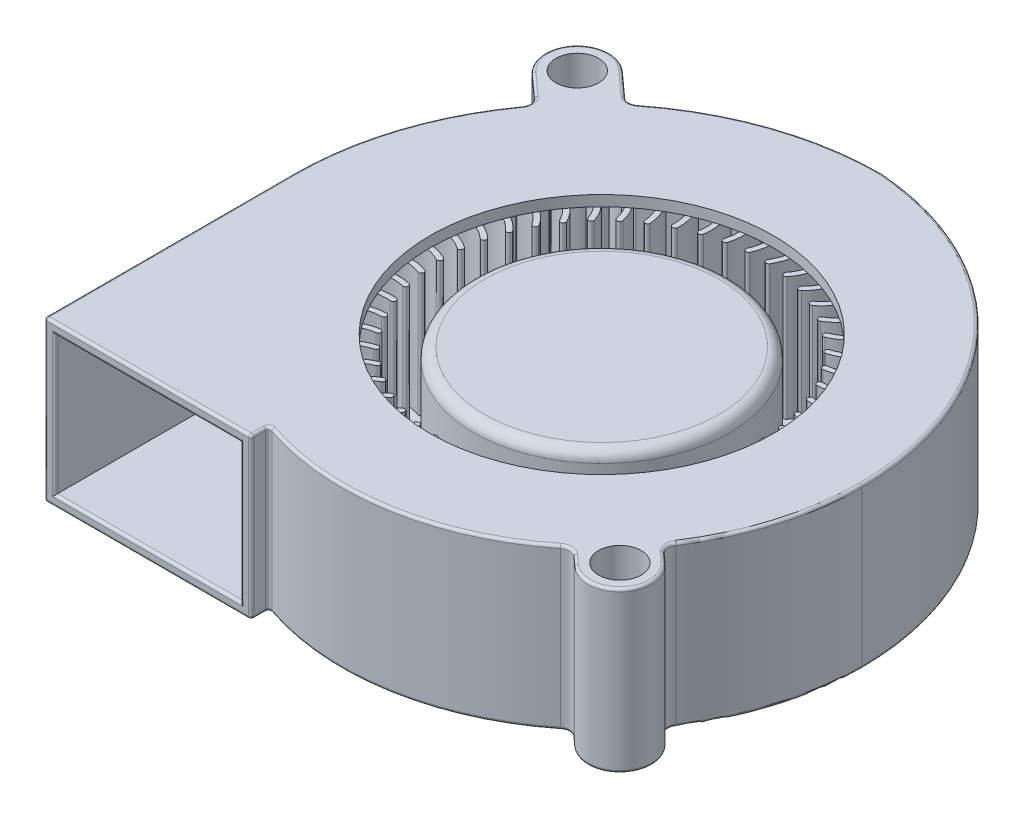
from build123d import *

# Parameters (mm, degrees)
BODY_DEPTH          = 7.499999986
BODY_DEPTH_BACK     = 7.499999986
SKETCH1_R           = 2
SKETCH1_R_2         = 16.1
SHELL_START         = -6.499999986
SHELL_OUTLINE_R     = 16.1
SHELL_DEPTH         = 12.999999972
SKETCH2_R           = 20.1
BOSS_EXTRUDE2_DEPTH = 1
SKETCH3_R           = 12
MOTOR_DEPTH         = 12.799999972
FILLET1_R           = 1
FILLET2_R           = 0.25
SKETCH9_R           = 19
BLADE_BASE_DEPTH    = 1
BLADE_DEPTH         = 11.599999972
BLADE_2_DEPTH       = 11.599999972
BLADE_3_DEPTH       = 11.599999972
BLADE_4_DEPTH       = 11.599999972
BLADE_5_DEPTH       = 11.599999972
BLADE_6_DEPTH       = 11.599999972
BLADE_7_DEPTH       = 11.599999972
BLADE_8_DEPTH       = 11.599999972
BLADE_9_DEPTH       = 11.599999972
BLADE_10_DEPTH      = 11.599999972
BLADE_11_DEPTH      = 11.599999972
BLADE_12_DEPTH      = 11.599999972
BLADE_13_DEPTH      = 11.599999972
BLADE_14_DEPTH      = 11.599999972
BLADE_15_DEPTH      = 11.599999972
BLADE_16_DEPTH      = 11.599999972
BLADE_17_DEPTH      = 11.599999972
BLADE_18_DEPTH      = 11.599999972
BLADE_19_DEPTH      = 11.599999972
BLADE_20_DEPTH      = 11.599999972
BLADE_21_DEPTH      = 11.599999972
BLADE_22_DEPTH      = 11.599999972
BLADE_23_DEPTH      = 11.599999972
BLADE_24_DEPTH      = 11.599999972
BLADE_25_DEPTH      = 11.599999972
BLADE_26_DEPTH      = 11.599999972
BLADE_27_DEPTH      = 11.599999972
BLADE_28_DEPTH      = 11.599999972
BLADE_29_DEPTH      = 11.599999972
BLADE_30_DEPTH      = 11.599999972
BLADE_31_DEPTH      = 11.599999972
BLADE_32_DEPTH      = 11.599999972
BLADE_33_DEPTH      = 11.599999972
BLADE_34_DEPTH      = 11.599999972
BLADE_35_DEPTH      = 11.599999972
BLADE_36_DEPTH      = 11.599999972
BLADE_37_DEPTH      = 11.599999972
BLADE_38_DEPTH      = 11.599999972
BLADE_39_DEPTH      = 11.599999972
BLADE_40_DEPTH      = 11.599999972
BLADE_41_DEPTH      = 11.599999972
BLADE_42_DEPTH      = 11.599999972
BLADE_43_DEPTH      = 11.599999972
BLADE_44_DEPTH      = 11.599999972
BLADE_45_DEPTH      = 11.599999972
BLADE_46_DEPTH      = 11.599999972
BLADE_47_DEPTH      = 11.599999972
BLADE_48_DEPTH      = 11.599999972
BLADE_49_DEPTH      = 11.599999972
BLADE_50_DEPTH      = 11.599999972


# Read off the part's stored shape, not the designer's step: Shell
with BuildPart() as part:
    # Sketch1 → BODY (new, two sides: drawn at the far end of the back side and taken through both)
    with BuildSketch(Plane(origin=(0, 0, 0), x_dir=(1, 0, 0), z_dir=(0, 1, 0)).offset(-BODY_DEPTH_BACK)):
        with BuildLine():
            Line((-8.2, -24.7), (-27.6, -24.7))
            Line((-27.6, -24.7), (-27.6, -1.3))
            ThreePointArc((-27.6, -1.3), (-26.262276369, 7.188394425), (-22.378779717, 14.853953646))
            ThreePointArc((-22.378779717, 14.853953646), (-22.195118856, 15.544109225), (-22.518691745, 16.1807776))
            Line((-22.518691745, 16.1807776), (-24.612739972, 18.075392663))
            ThreePointArc((-24.612739972, 18.075392663), (-24.824607337, 22.312739972), (-20.587260028, 22.524607337))
            Line((-20.587260028, 22.524607337), (-18.314120005, 20.467956841))
            ThreePointArc((-18.314120005, 20.467956841), (-17.678523285, 20.210116446), (-17.026311343, 20.422447423))
            ThreePointArc((-17.026311343, 20.422447423), (-9.00612156, 24.789265502), (0, 26.3))
            ThreePointArc((0, 26.3), (17.36055533, 17.937739545), (24.4, 0))
            ThreePointArc((24.4, 0), (23.375338292, -6.996682051), (20.387413137, -13.405722121))
            ThreePointArc((20.387413137, -13.405722121), (20.23099708, -14.081643481), (20.552049532, -14.696672741))
            Line((20.552049532, -14.696672741), (21.412739972, -15.475392663))
            ThreePointArc((21.412739972, -15.475392663), (21.624607337, -19.712739972), (17.387260028, -19.924607337))
            Line((17.387260028, -19.924607337), (16.500680289, -19.122463764))
            ThreePointArc((16.500680289, -19.122463764), (15.861055579, -18.864489151), (15.206547793, -19.081952317))
            ThreePointArc((15.206547793, -19.081952317), (4.009152204, -24.068375487), (-8.2, -22.980861603))
            Line((-8.2, -22.980861603), (-8.2, -24.7))
        make_face()
        with Locations(Location((-22.6, 20.3, 0), (0, 0, 270))):
            Circle(SKETCH1_R, mode=Mode.SUBTRACT)
        with Locations(Location((19.4, -17.7, 0), (0, 0, 270))):
            Circle(SKETCH1_R, mode=Mode.SUBTRACT)
        with Locations(Location((0, 0, 0), (0, 0, 270))):
            Circle(SKETCH1_R_2, mode=Mode.SUBTRACT)
    extrude(amount=BODY_DEPTH + BODY_DEPTH_BACK)

    # Shell outline → Shell (cut)
    with BuildSketch(Plane(origin=(0, 0, 0), x_dir=(1, 0, 0), z_dir=(0, 1, 0)).offset(SHELL_START)):
        with BuildLine():
            ThreePointArc((-19.600048942, 20.282863759), (-20.375392663, 18.287260028), (-22.283702238, 17.316720642))
            Line((-22.283702238, 17.316720642), (-21.847778421, 16.922313379))
            ThreePointArc((-21.847778421, 16.922313379), (-21.200632643, 15.648976628), (-21.567954365, 14.26866547))
            ThreePointArc((-21.567954365, 14.26866547), (-25.310744617, 6.880843902), (-26.6, -1.3))
            Line((-26.6, -1.3), (-26.6, -24.7))
            Line((-26.6, -24.7), (-9.2, -24.7))
            Line((-9.2, -24.7), (-9.2, -21.515575753))
            ThreePointArc((-9.2, -21.515575753), (3.135313575, -23.189001893), (14.583328621, -18.299905091))
            ThreePointArc((14.583328621, -18.299905091), (15.453748302, -17.899665059), (16.410447581, -17.950152626))
            ThreePointArc((16.410447581, -17.950152626), (17.180842903, -15.681252424), (19.366916719, -14.700182423))
            ThreePointArc((19.366916719, -14.700182423), (19.232948318, -13.755532004), (19.551863418, -12.85630728))
            ThreePointArc((19.551863418, -12.85630728), (22.417332624, -6.709932787), (23.4, 0))
            ThreePointArc((23.4, 0), (16.64019784, 17.243873762), (-0.037492747, 25.299973577))
            ThreePointArc((-0.037492747, 25.299973577), (-8.697530915, 23.837878908), (-16.409416004, 19.635402227))
            ThreePointArc((-16.409416004, 19.635402227), (-17.713839887, 19.210740271), (-18.985033329, 19.726421061))
            Line((-18.985033329, 19.726421061), (-19.600048942, 20.282863759))
        make_face()
        Circle(SHELL_OUTLINE_R, mode=Mode.SUBTRACT)
    extrude(amount=SHELL_DEPTH, mode=Mode.SUBTRACT)

    # Sketch2 → Boss-Extrude2 (add)
    with BuildSketch(Plane.XZ.offset(7.499999986)):
        Circle(SKETCH2_R)
    extrude(amount=-BOSS_EXTRUDE2_DEPTH)

    # Fillet2
    fillet2_edges = [part.edges().sort_by_distance(p)[0] for p in [
        (15.861055579, -7.499999986, 18.864489151),
        (-9.2, 0, 24.7),
        (-17.9, -6.499999986, 24.7),
        (-26.6, 0, 24.7),
        (-17.9, 6.499999986, 24.7),
        (16.943970158, -7.499999986, 19.523535551),
        (21.624607337, -7.499999986, 19.712739972),
        (20.982394752, -7.499999986, 15.086032702),
        (20.23099708, -7.499999986, 14.081643481),
        (23.375338292, -7.499999986, 6.996682051),
        (17.36055533, -7.499999986, -17.937739545),
        (-8.2, 0, 24.7),
        (-27.6, 0, 24.7),
        (-8.2, 0, 22.980861603),
        (-9.00612156, -7.499999986, -24.789265502),
        (-17.678523285, -7.499999986, -20.210116446),
        (-19.450690017, -7.499999986, -21.496282089),
        (-8.2, -7.499999986, 23.840430801),
        (-24.824607337, -7.499999986, -22.312739972),
        (-23.565715858, -7.499999986, -17.128085131),
        (-22.195118856, -7.499999986, -15.544109225),
        (-26.262276369, -7.499999986, -7.188394425),
        (-27.6, -7.499999986, 13),
        (-8.2, 7.499999986, 23.840430801),
        (4.009152204, 7.499999986, 24.068375487),
        (15.861055579, 7.499999986, 18.864489151),
        (16.943970158, 7.499999986, 19.523535551),
        (21.624607337, 7.499999986, 19.712739972),
        (20.982394752, 7.499999986, 15.086032702),
        (20.23099708, 7.499999986, 14.081643481),
        (-17.9, -7.499999986, 24.7),
        (23.375338292, 7.499999986, 6.996682051),
        (17.36055533, 7.499999986, -17.937739545),
        (-9.00612156, 7.499999986, -24.789265502),
        (-17.678523285, 7.499999986, -20.210116446),
        (-19.450690017, 7.499999986, -21.496282089),
        (-24.824607337, 7.499999986, -22.312739972),
        (-23.565715858, 7.499999986, -17.128085131),
        (-22.195118856, 7.499999986, -15.544109225),
        (-26.262276369, 7.499999986, -7.188394425),
        (-27.6, 7.499999986, 13),
        (-17.9, 7.499999986, 24.7),
        (4.009152204, -7.499999986, 24.068375487),
    ]]
    fillet(fillet2_edges, radius=FILLET2_R)


with BuildPart() as body_2:
    # Sketch3 → MOTOR (new body)
    with BuildSketch(Plane(origin=(0, -6.299999986, 0), x_dir=(1, 0, 0), z_dir=(0, 1, 0))):
        with Locations(Location((0, 0, 0), (0, 0, 90))):
            Circle(SKETCH3_R)
    extrude(amount=MOTOR_DEPTH)

    # Fillet1
    fillet1_edges = [body_2.edges().sort_by_distance(p)[0] for p in [
        (0, 6.499999986, 12),
    ]]
    fillet(fillet1_edges, radius=FILLET1_R)


with BuildPart() as body_3:
    # Sketch9 → BLADE BASE (new body)
    with BuildSketch(Plane(origin=(0, -6.299999986, 0), x_dir=(1, 0, 0), z_dir=(0, 1, 0))):
        with Locations(Location((0, 0, 0), (0, 0, 270))):
            Circle(SKETCH9_R)
    extrude(amount=BLADE_BASE_DEPTH)


with BuildPart() as body_4:
    # Sketch10 → BLADE (new body)
    with BuildSketch(Plane(origin=(0, -5.299999986, 0), x_dir=(1, 0, 0), z_dir=(0, 1, 0))):
        with BuildLine():
            ThreePointArc((-18.866349436, 0), (-16.866349436, 0.5), (-14.866349436, 0))
            ThreePointArc((-14.866349436, 0), (-14.76340826, -0.338235294), (-15.101643554, -0.441176471))
            ThreePointArc((-15.101643554, -0.441176471), (-16.866349436, 0), (-18.631055318, -0.441176471))
            ThreePointArc((-18.631055318, -0.441176471), (-18.969290613, -0.338235294), (-18.866349436, 0))
        make_face()
    extrude(amount=BLADE_DEPTH)


with BuildPart() as body_5:
    # Sketch10 → BLADE 2 (new body)
    with BuildSketch(Plane(origin=(0, -5.299999986, 0), x_dir=(1, 0, 0), z_dir=(0, 1, 0))):
        with BuildLine():
            ThreePointArc((-18.717582636, 2.36458058), (-18.862104213, 2.041914323), (-18.539437956, 1.897392745))
            ThreePointArc((-18.539437956, 1.897392745), (-16.733353233, 2.113914113), (-15.037856657, 1.455040156))
            ThreePointArc((-15.037856657, 1.455040156), (-14.689386499, 1.514777488), (-14.74912383, 1.863247646))
            ThreePointArc((-14.74912383, 1.863247646), (-16.670686616, 2.609971464), (-18.717582636, 2.36458058))
        make_face()
    extrude(amount=BLADE_2_DEPTH)


with BuildPart() as body_6:
    # Sketch10 → BLADE 3 (new body)
    with BuildSketch(Plane(origin=(0, -5.299999986, 0), x_dir=(1, 0, 0), z_dir=(0, 1, 0))):
        with BuildLine():
            ThreePointArc((-18.273628376, 4.691870312), (-18.457451163, 4.389861732), (-18.155442582, 4.206038944))
            ThreePointArc((-18.155442582, 4.206038944), (-16.336462053, 4.194490538), (-14.736913778, 3.328309931))
            ThreePointArc((-14.736913778, 3.328309931), (-14.383704338, 3.343901324), (-14.399295731, 3.697110764))
            ThreePointArc((-14.399295731, 3.697110764), (-16.21211711, 4.678782119), (-18.273628376, 4.691870312))
        make_face()
    extrude(amount=BLADE_3_DEPTH)


with BuildPart() as body_7:
    # Sketch10 → BLADE 4 (new body)
    with BuildSketch(Plane(origin=(0, -5.299999986, 0), x_dir=(1, 0, 0), z_dir=(0, 1, 0))):
        with BuildLine():
            ThreePointArc((-17.54148808, 6.945166447), (-17.761713082, 6.668578398), (-17.485125033, 6.448353397))
            ThreePointArc((-17.485125033, 6.448353397), (-15.681935108, 6.208917342), (-14.203560965, 5.14909027))
            ThreePointArc((-14.203560965, 5.14909027), (-13.851182568, 5.120289838), (-13.822382137, 5.472668236))
            ThreePointArc((-13.822382137, 5.472668236), (-15.497872832, 6.673805585), (-17.54148808, 6.945166447))
        make_face()
    extrude(amount=BLADE_4_DEPTH)


with BuildPart() as body_8:
    # Sketch10 → BLADE 5 (new body)
    with BuildSketch(Plane(origin=(0, -5.299999986, 0), x_dir=(1, 0, 0), z_dir=(0, 1, 0))):
        with BuildLine():
            ThreePointArc((-16.532708039, 9.088933158), (-16.785862175, 8.8421276), (-16.539056617, 8.588973464))
            ThreePointArc((-16.539056617, 8.588973464), (-14.780094679, 8.12542581), (-13.446209511, 6.888666379))
            ThreePointArc((-13.446209511, 6.888666379), (-13.100219374, 6.815928324), (-13.027481319, 7.161918461))
            ThreePointArc((-13.027481319, 7.161918461), (-14.539217842, 8.56357915), (-16.532708039, 9.088933158))
        make_face()
    extrude(amount=BLADE_5_DEPTH)


with BuildPart() as body_9:
    # Sketch10 → BLADE 6 (new body)
    with BuildSketch(Plane(origin=(0, -5.299999986, 0), x_dir=(1, 0, 0), z_dir=(0, 1, 0))):
        with BuildLine():
            ThreePointArc((-15.263197316, 11.089361963), (-15.545288194, 10.876231167), (-15.332157399, 10.594140289))
            ThreePointArc((-15.332157399, 10.594140289), (-13.645163327, 9.913791459), (-12.476803301, 8.519604104))
            ThreePointArc((-12.476803301, 8.519604104), (-12.142657895, 8.404075548), (-12.027129338, 8.738220954))
            ThreePointArc((-12.027129338, 8.738220954), (-13.351270701, 10.318299956), (-15.263197316, 11.089361963))
        make_face()
    extrude(amount=BLADE_6_DEPTH)


with BuildPart() as body_10:
    # Sketch10 → BLADE 7 (new body)
    with BuildSketch(Plane(origin=(0, -5.299999986, 0), x_dir=(1, 0, 0), z_dir=(0, 1, 0))):
        with BuildLine():
            ThreePointArc((-13.752976853, 12.914904906), (-14.059555733, 12.738810072), (-13.883460899, 12.432231192))
            ThreePointArc((-13.883460899, 12.432231192), (-12.295039598, 11.545810694), (-11.310630449, 10.016182583))
            ThreePointArc((-11.310630449, 10.016182583), (-10.993599447, 9.85968548), (-10.837102343, 10.176716482))
            ThreePointArc((-10.837102343, 10.176716482), (-11.952766045, 11.910295008), (-13.752976853, 12.914904906))
        make_face()
    extrude(amount=BLADE_7_DEPTH)


with BuildPart() as body_11:
    # Sketch10 → BLADE 8 (new body)
    with BuildSketch(Plane(origin=(0, -5.299999986, 0), x_dir=(1, 0, 0), z_dir=(0, 1, 0))):
        with BuildLine():
            ThreePointArc((-12.02586373, 14.536772083), (-12.352095678, 14.400490332), (-12.215813927, 14.074258384))
            ThreePointArc((-12.215813927, 14.074258384), (-10.75101575, 12.995745598), (-9.966082199, 11.35479988))
            ThreePointArc((-9.966082199, 11.35479988), (-9.671165368, 11.159802282), (-9.476167771, 11.454719112))
            ThreePointArc((-9.476167771, 11.454719112), (-10.365759129, 13.314457593), (-12.02586373, 14.536772083))
        make_face()
    extrude(amount=BLADE_8_DEPTH)


with BuildPart() as body_12:
    # Sketch10 → BLADE 9 (new body)
    with BuildSketch(Plane(origin=(0, -5.299999986, 0), x_dir=(1, 0, 0), z_dir=(0, 1, 0))):
        with BuildLine():
            ThreePointArc((-10.109095551, 15.929385681), (-10.449835696, 15.835066258), (-10.355516273, 15.494326113))
            ThreePointArc((-10.355516273, 15.494326113), (-9.037441961, 14.24072983), (-8.464362878, 12.514345199))
            ThreePointArc((-8.464362878, 12.514345199), (-8.196211235, 12.283922336), (-7.965788371, 12.552073979))
            ThreePointArc((-7.965788371, 12.552073979), (-8.615277999, 14.508643228), (-10.109095551, 15.929385681))
        make_face()
    extrude(amount=BLADE_9_DEPTH)


with BuildPart() as body_13:
    # Sketch10 → BLADE 10 (new body)
    with BuildSketch(Plane(origin=(0, -5.299999986, 0), x_dir=(1, 0, 0), z_dir=(0, 1, 0))):
        with BuildLine():
            ThreePointArc((-8.032900897, 17.070783351), (-8.382775563, 17.019913728), (-8.33190594, 16.670039063))
            ThreePointArc((-8.33190594, 16.670039063), (-7.181342314, 15.261129246), (-6.829155499, 13.476531819))
            ThreePointArc((-6.829155499, 13.476531819), (-6.591997954, 13.214317596), (-6.329783731, 13.451475141))
            ThreePointArc((-6.329783731, 13.451475141), (-6.728928788, 15.474018892), (-8.032900897, 17.070783351))
        make_face()
    extrude(amount=BLADE_10_DEPTH)


with BuildPart() as body_14:
    # Sketch10 → BLADE 11 (new body)
    with BuildSketch(Plane(origin=(0, -5.299999986, 0), x_dir=(1, 0, 0), z_dir=(0, 1, 0))):
        with BuildLine():
            ThreePointArc((-5.830022598, 17.94296457), (-6.183514051, 17.936346993), (-6.176896474, 17.582855539))
            ThreePointArc((-6.176896474, 17.582855539), (-5.211988609, 16.040851537), (-5.086248258, 14.226185482))
            ThreePointArc((-5.086248258, 14.226185482), (-4.883824928, 13.936315174), (-4.59395462, 14.138738505))
            ThreePointArc((-4.59395462, 14.138738505), (-4.736460351, 16.195360034), (-5.830022598, 17.94296457))
        make_face()
    extrude(amount=BLADE_11_DEPTH)


with BuildPart() as body_15:
    # Sketch10 → BLADE 12 (new body)
    with BuildSketch(Plane(origin=(0, -5.299999986, 0), x_dir=(1, 0, 0), z_dir=(0, 1, 0))):
        with BuildLine():
            ThreePointArc((-3.535201359, 18.532174519), (-3.886734829, 18.56991335), (-3.92447366, 18.21837988))
            ThreePointArc((-3.92447366, 18.21837988), (-3.16043873, 16.567600017), (-3.263127844, 14.751483701))
            ThreePointArc((-3.263127844, 14.751483701), (-3.098631065, 14.438528737), (-2.7856761, 14.603025516))
            ThreePointArc((-2.7856761, 14.603025516), (-2.669295104, 16.661290675), (-3.535201359, 18.532174519))
        make_face()
    extrude(amount=BLADE_12_DEPTH)


with BuildPart() as body_16:
    # Sketch10 → BLADE 13 (new body)
    with BuildSketch(Plane(origin=(0, -5.299999986, 0), x_dir=(1, 0, 0), z_dir=(0, 1, 0))):
        with BuildLine():
            ThreePointArc((-1.184627883, 18.829121005), (-1.528659477, 18.910621081), (-1.610159552, 18.566589487))
            ThreePointArc((-1.610159552, 18.566589487), (-1.059046844, 16.833067548), (-1.388545954, 15.04414221))
            ThreePointArc((-1.388545954, 15.04414221), (-1.264569939, 14.713038076), (-0.933465805, 14.837014091))
            ThreePointArc((-0.933465805, 14.837014091), (-0.560033479, 16.864462808), (-1.184627883, 18.829121005))
        make_face()
    extrude(amount=BLADE_13_DEPTH)


with BuildPart() as body_17:
    # Sketch10 → BLADE 14 (new body)
    with BuildSketch(Plane(origin=(0, -5.299999986, 0), x_dir=(1, 0, 0), z_dir=(0, 1, 0))):
        with BuildLine():
            ThreePointArc((1.184627883, 18.829121005), (0.853523749, 18.95309702), (0.729547733, 18.621992886))
            ThreePointArc((0.729547733, 18.621992886), (1.059046844, 16.833067548), (0.507934135, 15.09954561))
            ThreePointArc((0.507934135, 15.09954561), (0.589434211, 14.755514016), (0.933465805, 14.837014091))
            ThreePointArc((0.933465805, 14.837014091), (1.558060208, 16.801672288), (1.184627883, 18.829121005))
        make_face()
    extrude(amount=BLADE_14_DEPTH)


with BuildPart() as body_18:
    # Sketch10 → BLADE 15 (new body)
    with BuildSketch(Plane(origin=(0, -5.299999986, 0), x_dir=(1, 0, 0), z_dir=(0, 1, 0))):
        with BuildLine():
            ThreePointArc((3.535201359, 18.532174519), (3.222246395, 18.696671298), (3.057749615, 18.383716334))
            ThreePointArc((3.057749615, 18.383716334), (3.16043873, 16.567600017), (2.396403799, 14.916820155))
            ThreePointArc((2.396403799, 14.916820155), (2.43414263, 14.565286685), (2.7856761, 14.603025516))
            ThreePointArc((2.7856761, 14.603025516), (3.651582355, 16.47390936), (3.535201359, 18.532174519))
        make_face()
    extrude(amount=BLADE_15_DEPTH)


with BuildPart() as body_19:
    # Sketch10 → BLADE 16 (new body)
    with BuildSketch(Plane(origin=(0, -5.299999986, 0), x_dir=(1, 0, 0), z_dir=(0, 1, 0))):
        with BuildLine():
            ThreePointArc((5.830022598, 17.94296457), (5.54015229, 18.145387901), (5.337728959, 17.855517593))
            ThreePointArc((5.337728959, 17.855517593), (5.211988609, 16.040851537), (4.247080744, 14.498847535))
            ThreePointArc((4.247080744, 14.498847535), (4.240463167, 14.145356082), (4.59395462, 14.138738505))
            ThreePointArc((4.59395462, 14.138738505), (5.687516867, 15.88634304), (5.830022598, 17.94296457))
        make_face()
    extrude(amount=BLADE_16_DEPTH)


with BuildPart() as body_20:
    # Sketch10 → BLADE 17 (new body)
    with BuildSketch(Plane(origin=(0, -5.299999986, 0), x_dir=(1, 0, 0), z_dir=(0, 1, 0))):
        with BuildLine():
            ThreePointArc((8.032900897, 17.070783351), (7.770686674, 17.307940896), (7.533529129, 17.045726673))
            ThreePointArc((7.533529129, 17.045726673), (7.181342314, 15.261129246), (6.030778688, 13.852219429))
            ThreePointArc((6.030778688, 13.852219429), (5.979909066, 13.502344764), (6.329783731, 13.451475141))
            ThreePointArc((6.329783731, 13.451475141), (7.63375584, 15.0482396), (8.032900897, 17.070783351))
        make_face()
    extrude(amount=BLADE_17_DEPTH)


with BuildPart() as body_21:
    # Sketch10 → BLADE 18 (new body)
    with BuildSketch(Plane(origin=(0, -5.299999986, 0), x_dir=(1, 0, 0), z_dir=(0, 1, 0))):
        with BuildLine():
            ThreePointArc((10.109095551, 15.929385681), (9.878672688, 16.197537325), (9.610521044, 15.967114461))
            ThreePointArc((9.610521044, 15.967114461), (9.037441961, 14.24072983), (7.71936765, 12.987133548))
            ThreePointArc((7.71936765, 12.987133548), (7.625048226, 12.646393403), (7.965788371, 12.552073979))
            ThreePointArc((7.965788371, 12.552073979), (9.459605924, 13.972816433), (10.109095551, 15.929385681))
        make_face()
    extrude(amount=BLADE_18_DEPTH)


with BuildPart() as body_22:
    # Sketch10 → BLADE 19 (new body)
    with BuildSketch(Plane(origin=(0, -5.299999986, 0), x_dir=(1, 0, 0), z_dir=(0, 1, 0))):
        with BuildLine():
            ThreePointArc((12.02586373, 14.536772083), (11.830866132, 14.831688914), (11.535949301, 14.636691316))
            ThreePointArc((11.535949301, 14.636691316), (10.75101575, 12.995745598), (9.286217573, 11.917232812))
            ThreePointArc((9.286217573, 11.917232812), (9.149935822, 11.591000863), (9.476167771, 11.454719112))
            ThreePointArc((9.476167771, 11.454719112), (11.136272371, 12.677033603), (12.02586373, 14.536772083))
        make_face()
    extrude(amount=BLADE_19_DEPTH)


with BuildPart() as body_23:
    # Sketch10 → BLADE 20 (new body)
    with BuildSketch(Plane(origin=(0, -5.299999986, 0), x_dir=(1, 0, 0), z_dir=(0, 1, 0))):
        with BuildLine():
            ThreePointArc((13.752976853, 12.914904906), (13.596479749, 13.231935908), (13.279448747, 13.075438805))
            ThreePointArc((13.279448747, 13.075438805), (12.295039598, 11.545810694), (10.706618297, 10.659390196))
            ThreePointArc((10.706618297, 10.659390196), (10.530523463, 10.352811316), (10.837102343, 10.176716482))
            ThreePointArc((10.837102343, 10.176716482), (12.637313151, 11.18132638), (13.752976853, 12.914904906))
        make_face()
    extrude(amount=BLADE_20_DEPTH)


with BuildPart() as body_24:
    # Sketch10 → BLADE 21 (new body)
    with BuildSketch(Plane(origin=(0, -5.299999986, 0), x_dir=(1, 0, 0), z_dir=(0, 1, 0))):
        with BuildLine():
            ThreePointArc((15.263197316, 11.089361963), (15.147668759, 11.42350737), (14.813523353, 11.307978813))
            ThreePointArc((14.813523353, 11.307978813), (13.645163327, 9.913791459), (11.958169255, 9.233442628))
            ThreePointArc((11.958169255, 9.233442628), (11.745038459, 8.95135175), (12.027129338, 8.738220954))
            ThreePointArc((12.027129338, 8.738220954), (13.939055953, 9.509282961), (15.263197316, 11.089361963))
        make_face()
    extrude(amount=BLADE_21_DEPTH)


with BuildPart() as body_25:
    # Sketch10 → BLADE 22 (new body)
    with BuildSketch(Plane(origin=(0, -5.299999986, 0), x_dir=(1, 0, 0), z_dir=(0, 1, 0))):
        with BuildLine():
            ThreePointArc((16.532708039, 9.088933158), (16.459969984, 9.434923295), (16.113979846, 9.36218524))
            ThreePointArc((16.113979846, 9.36218524), (14.780094679, 8.12542581), (13.02113274, 7.661878155))
            ThreePointArc((13.02113274, 7.661878155), (12.774327182, 7.408724019), (13.027481319, 7.161918461))
            ThreePointArc((13.027481319, 7.161918461), (15.020971516, 7.687272469), (16.532708039, 9.088933158))
        make_face()
    extrude(amount=BLADE_22_DEPTH)


with BuildPart() as body_26:
    # Sketch10 → BLADE 23 (new body)
    with BuildSketch(Plane(origin=(0, -5.299999986, 0), x_dir=(1, 0, 0), z_dir=(0, 1, 0))):
        with BuildLine():
            ThreePointArc((17.54148808, 6.945166447), (17.512687649, 7.297544845), (17.160309251, 7.268744414))
            ThreePointArc((17.160309251, 7.268744414), (15.681935108, 6.208917342), (13.878745184, 5.969481286))
            ThreePointArc((13.878745184, 5.969481286), (13.602157135, 5.749256285), (13.822382137, 5.472668236))
            ThreePointArc((13.822382137, 5.472668236), (15.865997385, 5.744029099), (17.54148808, 6.945166447))
        make_face()
    extrude(amount=BLADE_23_DEPTH)


with BuildPart() as body_27:
    # Sketch10 → BLADE 24 (new body)
    with BuildSketch(Plane(origin=(0, -5.299999986, 0), x_dir=(1, 0, 0), z_dir=(0, 1, 0))):
        with BuildLine():
            ThreePointArc((18.273628376, 4.691870312), (18.289219769, 5.045079752), (17.936010329, 5.060671145))
            ThreePointArc((17.936010329, 5.060671145), (16.336462053, 4.194490538), (14.517481525, 4.182942132))
            ThreePointArc((14.517481525, 4.182942132), (14.215472944, 3.999119345), (14.399295731, 3.697110764))
            ThreePointArc((14.399295731, 3.697110764), (16.460806997, 3.710198958), (18.273628376, 4.691870312))
        make_face()
    extrude(amount=BLADE_24_DEPTH)


with BuildPart() as body_28:
    # Sketch10 → BLADE 25 (new body)
    with BuildSketch(Plane(origin=(0, -5.299999986, 0), x_dir=(1, 0, 0), z_dir=(0, 1, 0))):
        with BuildLine():
            ThreePointArc((18.717582636, 2.36458058), (18.777319967, 2.713050739), (18.428849809, 2.77278807))
            ThreePointArc((18.428849809, 2.77278807), (16.733353233, 2.113914113), (14.92726851, 2.330435481))
            ThreePointArc((14.92726851, 2.330435481), (14.604602253, 2.185913903), (14.74912383, 1.863247646))
            ThreePointArc((14.74912383, 1.863247646), (16.79601985, 1.617856763), (18.717582636, 2.36458058))
        make_face()
    extrude(amount=BLADE_25_DEPTH)


with BuildPart() as body_29:
    # Sketch10 → BLADE 26 (new body)
    with BuildSketch(Plane(origin=(0, -5.299999986, 0), x_dir=(1, 0, 0), z_dir=(0, 1, 0))):
        with BuildLine():
            ThreePointArc((18.866349436, 0), (18.969290613, 0.338235294), (18.631055318, 0.441176471))
            ThreePointArc((18.631055318, 0.441176471), (16.866349436, 0), (15.101643554, 0.441176471))
            ThreePointArc((15.101643554, 0.441176471), (14.76340826, 0.338235294), (14.866349436, 0))
            ThreePointArc((14.866349436, 0), (16.866349436, -0.5), (18.866349436, 0))
        make_face()
    extrude(amount=BLADE_26_DEPTH)


with BuildPart() as body_30:
    # Sketch10 → BLADE 27 (new body)
    with BuildSketch(Plane(origin=(0, -5.299999986, 0), x_dir=(1, 0, 0), z_dir=(0, 1, 0))):
        with BuildLine():
            ThreePointArc((18.717582636, -2.36458058), (18.862104213, -2.041914323), (18.539437956, -1.897392745))
            ThreePointArc((18.539437956, -1.897392745), (16.733353233, -2.113914113), (15.037856657, -1.455040156))
            ThreePointArc((15.037856657, -1.455040156), (14.689386499, -1.514777488), (14.74912383, -1.863247646))
            ThreePointArc((14.74912383, -1.863247646), (16.670686616, -2.609971464), (18.717582636, -2.36458058))
        make_face()
    extrude(amount=BLADE_27_DEPTH)


with BuildPart() as body_31:
    # Sketch10 → BLADE 28 (new body)
    with BuildSketch(Plane(origin=(0, -5.299999986, 0), x_dir=(1, 0, 0), z_dir=(0, 1, 0))):
        with BuildLine():
            ThreePointArc((18.273628376, -4.691870312), (18.457451163, -4.389861732), (18.155442582, -4.206038944))
            ThreePointArc((18.155442582, -4.206038944), (16.336462053, -4.194490538), (14.736913778, -3.328309931))
            ThreePointArc((14.736913778, -3.328309931), (14.383704338, -3.343901324), (14.399295731, -3.697110764))
            ThreePointArc((14.399295731, -3.697110764), (16.21211711, -4.678782119), (18.273628376, -4.691870312))
        make_face()
    extrude(amount=BLADE_28_DEPTH)


with BuildPart() as body_32:
    # Sketch10 → BLADE 29 (new body)
    with BuildSketch(Plane(origin=(0, -5.299999986, 0), x_dir=(1, 0, 0), z_dir=(0, 1, 0))):
        with BuildLine():
            ThreePointArc((17.54148808, -6.945166447), (17.761713082, -6.668578398), (17.485125033, -6.448353397))
            ThreePointArc((17.485125033, -6.448353397), (15.681935108, -6.208917342), (14.203560965, -5.14909027))
            ThreePointArc((14.203560965, -5.14909027), (13.851182568, -5.120289838), (13.822382137, -5.472668236))
            ThreePointArc((13.822382137, -5.472668236), (15.497872832, -6.673805585), (17.54148808, -6.945166447))
        make_face()
    extrude(amount=BLADE_29_DEPTH)


with BuildPart() as body_33:
    # Sketch10 → BLADE 30 (new body)
    with BuildSketch(Plane(origin=(0, -5.299999986, 0), x_dir=(1, 0, 0), z_dir=(0, 1, 0))):
        with BuildLine():
            ThreePointArc((16.532708039, -9.088933158), (16.785862175, -8.8421276), (16.539056617, -8.588973464))
            ThreePointArc((16.539056617, -8.588973464), (14.780094679, -8.12542581), (13.446209511, -6.888666379))
            ThreePointArc((13.446209511, -6.888666379), (13.100219374, -6.815928324), (13.027481319, -7.161918461))
            ThreePointArc((13.027481319, -7.161918461), (14.539217842, -8.56357915), (16.532708039, -9.088933158))
        make_face()
    extrude(amount=BLADE_30_DEPTH)


with BuildPart() as body_34:
    # Sketch10 → BLADE 31 (new body)
    with BuildSketch(Plane(origin=(0, -5.299999986, 0), x_dir=(1, 0, 0), z_dir=(0, 1, 0))):
        with BuildLine():
            ThreePointArc((15.263197316, -11.089361963), (15.545288194, -10.876231167), (15.332157399, -10.594140289))
            ThreePointArc((15.332157399, -10.594140289), (13.645163327, -9.913791459), (12.476803301, -8.519604104))
            ThreePointArc((12.476803301, -8.519604104), (12.142657895, -8.404075548), (12.027129338, -8.738220954))
            ThreePointArc((12.027129338, -8.738220954), (13.351270701, -10.318299956), (15.263197316, -11.089361963))
        make_face()
    extrude(amount=BLADE_31_DEPTH)


with BuildPart() as body_35:
    # Sketch10 → BLADE 32 (new body)
    with BuildSketch(Plane(origin=(0, -5.299999986, 0), x_dir=(1, 0, 0), z_dir=(0, 1, 0))):
        with BuildLine():
            ThreePointArc((13.752976853, -12.914904906), (14.059555733, -12.738810072), (13.883460899, -12.432231192))
            ThreePointArc((13.883460899, -12.432231192), (12.295039598, -11.545810694), (11.310630449, -10.016182583))
            ThreePointArc((11.310630449, -10.016182583), (10.993599447, -9.85968548), (10.837102343, -10.176716482))
            ThreePointArc((10.837102343, -10.176716482), (11.952766045, -11.910295008), (13.752976853, -12.914904906))
        make_face()
    extrude(amount=BLADE_32_DEPTH)


with BuildPart() as body_36:
    # Sketch10 → BLADE 33 (new body)
    with BuildSketch(Plane(origin=(0, -5.299999986, 0), x_dir=(1, 0, 0), z_dir=(0, 1, 0))):
        with BuildLine():
            ThreePointArc((12.02586373, -14.536772083), (12.352095678, -14.400490332), (12.215813927, -14.074258384))
            ThreePointArc((12.215813927, -14.074258384), (10.75101575, -12.995745598), (9.966082199, -11.35479988))
            ThreePointArc((9.966082199, -11.35479988), (9.671165368, -11.159802282), (9.476167771, -11.454719112))
            ThreePointArc((9.476167771, -11.454719112), (10.365759129, -13.314457593), (12.02586373, -14.536772083))
        make_face()
    extrude(amount=BLADE_33_DEPTH)


with BuildPart() as body_37:
    # Sketch10 → BLADE 34 (new body)
    with BuildSketch(Plane(origin=(0, -5.299999986, 0), x_dir=(1, 0, 0), z_dir=(0, 1, 0))):
        with BuildLine():
            ThreePointArc((10.109095551, -15.929385681), (10.449835696, -15.835066258), (10.355516273, -15.494326113))
            ThreePointArc((10.355516273, -15.494326113), (9.037441961, -14.24072983), (8.464362878, -12.514345199))
            ThreePointArc((8.464362878, -12.514345199), (8.196211235, -12.283922336), (7.965788371, -12.552073979))
            ThreePointArc((7.965788371, -12.552073979), (8.615277999, -14.508643228), (10.109095551, -15.929385681))
        make_face()
    extrude(amount=BLADE_34_DEPTH)


with BuildPart() as body_38:
    # Sketch10 → BLADE 35 (new body)
    with BuildSketch(Plane(origin=(0, -5.299999986, 0), x_dir=(1, 0, 0), z_dir=(0, 1, 0))):
        with BuildLine():
            ThreePointArc((8.032900897, -17.070783351), (8.382775563, -17.019913728), (8.33190594, -16.670039063))
            ThreePointArc((8.33190594, -16.670039063), (7.181342314, -15.261129246), (6.829155499, -13.476531819))
            ThreePointArc((6.829155499, -13.476531819), (6.591997954, -13.214317596), (6.329783731, -13.451475141))
            ThreePointArc((6.329783731, -13.451475141), (6.728928788, -15.474018892), (8.032900897, -17.070783351))
        make_face()
    extrude(amount=BLADE_35_DEPTH)


with BuildPart() as body_39:
    # Sketch10 → BLADE 36 (new body)
    with BuildSketch(Plane(origin=(0, -5.299999986, 0), x_dir=(1, 0, 0), z_dir=(0, 1, 0))):
        with BuildLine():
            ThreePointArc((5.830022598, -17.94296457), (6.183514051, -17.936346993), (6.176896474, -17.582855539))
            ThreePointArc((6.176896474, -17.582855539), (5.211988609, -16.040851537), (5.086248258, -14.226185482))
            ThreePointArc((5.086248258, -14.226185482), (4.883824928, -13.936315174), (4.59395462, -14.138738505))
            ThreePointArc((4.59395462, -14.138738505), (4.736460351, -16.195360034), (5.830022598, -17.94296457))
        make_face()
    extrude(amount=BLADE_36_DEPTH)


with BuildPart() as body_40:
    # Sketch10 → BLADE 37 (new body)
    with BuildSketch(Plane(origin=(0, -5.299999986, 0), x_dir=(1, 0, 0), z_dir=(0, 1, 0))):
        with BuildLine():
            ThreePointArc((3.535201359, -18.532174519), (3.886734829, -18.56991335), (3.92447366, -18.21837988))
            ThreePointArc((3.92447366, -18.21837988), (3.16043873, -16.567600017), (3.263127844, -14.751483701))
            ThreePointArc((3.263127844, -14.751483701), (3.098631065, -14.438528737), (2.7856761, -14.603025516))
            ThreePointArc((2.7856761, -14.603025516), (2.669295104, -16.661290675), (3.535201359, -18.532174519))
        make_face()
    extrude(amount=BLADE_37_DEPTH)


with BuildPart() as body_41:
    # Sketch10 → BLADE 38 (new body)
    with BuildSketch(Plane(origin=(0, -5.299999986, 0), x_dir=(1, 0, 0), z_dir=(0, 1, 0))):
        with BuildLine():
            ThreePointArc((1.184627883, -18.829121005), (1.528659477, -18.910621081), (1.610159552, -18.566589487))
            ThreePointArc((1.610159552, -18.566589487), (1.059046844, -16.833067548), (1.388545954, -15.04414221))
            ThreePointArc((1.388545954, -15.04414221), (1.264569939, -14.713038076), (0.933465805, -14.837014091))
            ThreePointArc((0.933465805, -14.837014091), (0.560033479, -16.864462808), (1.184627883, -18.829121005))
        make_face()
    extrude(amount=BLADE_38_DEPTH)


with BuildPart() as body_42:
    # Sketch10 → BLADE 39 (new body)
    with BuildSketch(Plane(origin=(0, -5.299999986, 0), x_dir=(1, 0, 0), z_dir=(0, 1, 0))):
        with BuildLine():
            ThreePointArc((-1.184627883, -18.829121005), (-0.853523749, -18.95309702), (-0.729547733, -18.621992886))
            ThreePointArc((-0.729547733, -18.621992886), (-1.059046844, -16.833067548), (-0.507934135, -15.09954561))
            ThreePointArc((-0.507934135, -15.09954561), (-0.589434211, -14.755514016), (-0.933465805, -14.837014091))
            ThreePointArc((-0.933465805, -14.837014091), (-1.558060208, -16.801672288), (-1.184627883, -18.829121005))
        make_face()
    extrude(amount=BLADE_39_DEPTH)


with BuildPart() as body_43:
    # Sketch10 → BLADE 40 (new body)
    with BuildSketch(Plane(origin=(0, -5.299999986, 0), x_dir=(1, 0, 0), z_dir=(0, 1, 0))):
        with BuildLine():
            ThreePointArc((-3.535201359, -18.532174519), (-3.222246395, -18.696671298), (-3.057749615, -18.383716334))
            ThreePointArc((-3.057749615, -18.383716334), (-3.16043873, -16.567600017), (-2.396403799, -14.916820155))
            ThreePointArc((-2.396403799, -14.916820155), (-2.43414263, -14.565286685), (-2.7856761, -14.603025516))
            ThreePointArc((-2.7856761, -14.603025516), (-3.651582355, -16.47390936), (-3.535201359, -18.532174519))
        make_face()
    extrude(amount=BLADE_40_DEPTH)


with BuildPart() as body_44:
    # Sketch10 → BLADE 41 (new body)
    with BuildSketch(Plane(origin=(0, -5.299999986, 0), x_dir=(1, 0, 0), z_dir=(0, 1, 0))):
        with BuildLine():
            ThreePointArc((-5.830022598, -17.94296457), (-5.54015229, -18.145387901), (-5.337728959, -17.855517593))
            ThreePointArc((-5.337728959, -17.855517593), (-5.211988609, -16.040851537), (-4.247080744, -14.498847535))
            ThreePointArc((-4.247080744, -14.498847535), (-4.240463167, -14.145356082), (-4.59395462, -14.138738505))
            ThreePointArc((-4.59395462, -14.138738505), (-5.687516867, -15.88634304), (-5.830022598, -17.94296457))
        make_face()
    extrude(amount=BLADE_41_DEPTH)


with BuildPart() as body_45:
    # Sketch10 → BLADE 42 (new body)
    with BuildSketch(Plane(origin=(0, -5.299999986, 0), x_dir=(1, 0, 0), z_dir=(0, 1, 0))):
        with BuildLine():
            ThreePointArc((-8.032900897, -17.070783351), (-7.770686674, -17.307940896), (-7.533529129, -17.045726673))
            ThreePointArc((-7.533529129, -17.045726673), (-7.181342314, -15.261129246), (-6.030778688, -13.852219429))
            ThreePointArc((-6.030778688, -13.852219429), (-5.979909066, -13.502344764), (-6.329783731, -13.451475141))
            ThreePointArc((-6.329783731, -13.451475141), (-7.63375584, -15.0482396), (-8.032900897, -17.070783351))
        make_face()
    extrude(amount=BLADE_42_DEPTH)


with BuildPart() as body_46:
    # Sketch10 → BLADE 43 (new body)
    with BuildSketch(Plane(origin=(0, -5.299999986, 0), x_dir=(1, 0, 0), z_dir=(0, 1, 0))):
        with BuildLine():
            ThreePointArc((-10.109095551, -15.929385681), (-9.878672688, -16.197537325), (-9.610521044, -15.967114461))
            ThreePointArc((-9.610521044, -15.967114461), (-9.037441961, -14.24072983), (-7.71936765, -12.987133548))
            ThreePointArc((-7.71936765, -12.987133548), (-7.625048226, -12.646393403), (-7.965788371, -12.552073979))
            ThreePointArc((-7.965788371, -12.552073979), (-9.459605924, -13.972816433), (-10.109095551, -15.929385681))
        make_face()
    extrude(amount=BLADE_43_DEPTH)


with BuildPart() as body_47:
    # Sketch10 → BLADE 44 (new body)
    with BuildSketch(Plane(origin=(0, -5.299999986, 0), x_dir=(1, 0, 0), z_dir=(0, 1, 0))):
        with BuildLine():
            ThreePointArc((-12.02586373, -14.536772083), (-11.830866132, -14.831688914), (-11.535949301, -14.636691316))
            ThreePointArc((-11.535949301, -14.636691316), (-10.75101575, -12.995745598), (-9.286217573, -11.917232812))
            ThreePointArc((-9.286217573, -11.917232812), (-9.149935822, -11.591000863), (-9.476167771, -11.454719112))
            ThreePointArc((-9.476167771, -11.454719112), (-11.136272371, -12.677033603), (-12.02586373, -14.536772083))
        make_face()
    extrude(amount=BLADE_44_DEPTH)


with BuildPart() as body_48:
    # Sketch10 → BLADE 45 (new body)
    with BuildSketch(Plane(origin=(0, -5.299999986, 0), x_dir=(1, 0, 0), z_dir=(0, 1, 0))):
        with BuildLine():
            ThreePointArc((-13.752976853, -12.914904906), (-13.596479749, -13.231935908), (-13.279448747, -13.075438805))
            ThreePointArc((-13.279448747, -13.075438805), (-12.295039598, -11.545810694), (-10.706618297, -10.659390196))
            ThreePointArc((-10.706618297, -10.659390196), (-10.530523463, -10.352811316), (-10.837102343, -10.176716482))
            ThreePointArc((-10.837102343, -10.176716482), (-12.637313151, -11.18132638), (-13.752976853, -12.914904906))
        make_face()
    extrude(amount=BLADE_45_DEPTH)


with BuildPart() as body_49:
    # Sketch10 → BLADE 46 (new body)
    with BuildSketch(Plane(origin=(0, -5.299999986, 0), x_dir=(1, 0, 0), z_dir=(0, 1, 0))):
        with BuildLine():
            ThreePointArc((-15.263197316, -11.089361963), (-15.147668759, -11.42350737), (-14.813523353, -11.307978813))
            ThreePointArc((-14.813523353, -11.307978813), (-13.645163327, -9.913791459), (-11.958169255, -9.233442628))
            ThreePointArc((-11.958169255, -9.233442628), (-11.745038459, -8.95135175), (-12.027129338, -8.738220954))
            ThreePointArc((-12.027129338, -8.738220954), (-13.939055953, -9.509282961), (-15.263197316, -11.089361963))
        make_face()
    extrude(amount=BLADE_46_DEPTH)


with BuildPart() as body_50:
    # Sketch10 → BLADE 47 (new body)
    with BuildSketch(Plane(origin=(0, -5.299999986, 0), x_dir=(1, 0, 0), z_dir=(0, 1, 0))):
        with BuildLine():
            ThreePointArc((-16.532708039, -9.088933158), (-16.459969984, -9.434923295), (-16.113979846, -9.36218524))
            ThreePointArc((-16.113979846, -9.36218524), (-14.780094679, -8.12542581), (-13.02113274, -7.661878155))
            ThreePointArc((-13.02113274, -7.661878155), (-12.774327182, -7.408724019), (-13.027481319, -7.161918461))
            ThreePointArc((-13.027481319, -7.161918461), (-15.020971516, -7.687272469), (-16.532708039, -9.088933158))
        make_face()
    extrude(amount=BLADE_47_DEPTH)


with BuildPart() as body_51:
    # Sketch10 → BLADE 48 (new body)
    with BuildSketch(Plane(origin=(0, -5.299999986, 0), x_dir=(1, 0, 0), z_dir=(0, 1, 0))):
        with BuildLine():
            ThreePointArc((-17.54148808, -6.945166447), (-17.512687649, -7.297544845), (-17.160309251, -7.268744414))
            ThreePointArc((-17.160309251, -7.268744414), (-15.681935108, -6.208917342), (-13.878745184, -5.969481286))
            ThreePointArc((-13.878745184, -5.969481286), (-13.602157135, -5.749256285), (-13.822382137, -5.472668236))
            ThreePointArc((-13.822382137, -5.472668236), (-15.865997385, -5.744029099), (-17.54148808, -6.945166447))
        make_face()
    extrude(amount=BLADE_48_DEPTH)


with BuildPart() as body_52:
    # Sketch10 → BLADE 49 (new body)
    with BuildSketch(Plane(origin=(0, -5.299999986, 0), x_dir=(1, 0, 0), z_dir=(0, 1, 0))):
        with BuildLine():
            ThreePointArc((-18.273628376, -4.691870312), (-18.289219769, -5.045079752), (-17.936010329, -5.060671145))
            ThreePointArc((-17.936010329, -5.060671145), (-16.336462053, -4.194490538), (-14.517481525, -4.182942132))
            ThreePointArc((-14.517481525, -4.182942132), (-14.215472944, -3.999119345), (-14.399295731, -3.697110764))
            ThreePointArc((-14.399295731, -3.697110764), (-16.460806997, -3.710198958), (-18.273628376, -4.691870312))
        make_face()
    extrude(amount=BLADE_49_DEPTH)


with BuildPart() as body_53:
    # Sketch10 → BLADE 50 (new body)
    with BuildSketch(Plane(origin=(0, -5.299999986, 0), x_dir=(1, 0, 0), z_dir=(0, 1, 0))):
        with BuildLine():
            ThreePointArc((-18.717582636, -2.36458058), (-18.777319967, -2.713050739), (-18.428849809, -2.77278807))
            ThreePointArc((-18.428849809, -2.77278807), (-16.733353233, -2.113914113), (-14.92726851, -2.330435481))
            ThreePointArc((-14.92726851, -2.330435481), (-14.604602253, -2.185913903), (-14.74912383, -1.863247646))
            ThreePointArc((-14.74912383, -1.863247646), (-16.79601985, -1.617856763), (-18.717582636, -2.36458058))
        make_face()
    extrude(amount=BLADE_50_DEPTH)


solid = Compound([part.part, body_2.part, body_3.part, body_4.part, body_5.part, body_6.part, body_7.part, body_8.part, body_9.part, body_10.part, body_11.part, body_12.part, body_13.part, body_14.part, body_15.part, body_16.part, body_17.part, body_18.part, body_19.part, body_20.part, body_21.part, body_22.part, body_23.part, body_24.part, body_25.part, body_26.part, body_27.part, body_28.part, body_29.part, body_30.part, body_31.part, body_32.part, body_33.part, body_34.part, body_35.part, body_36.part, body_37.part, body_38.part, body_39.part, body_40.part, body_41.part, body_42.part, body_43.part, body_44.part, body_45.part, body_46.part, body_47.part, body_48.part, body_49.part, body_50.part, body_51.part, body_52.part, body_53.part])
